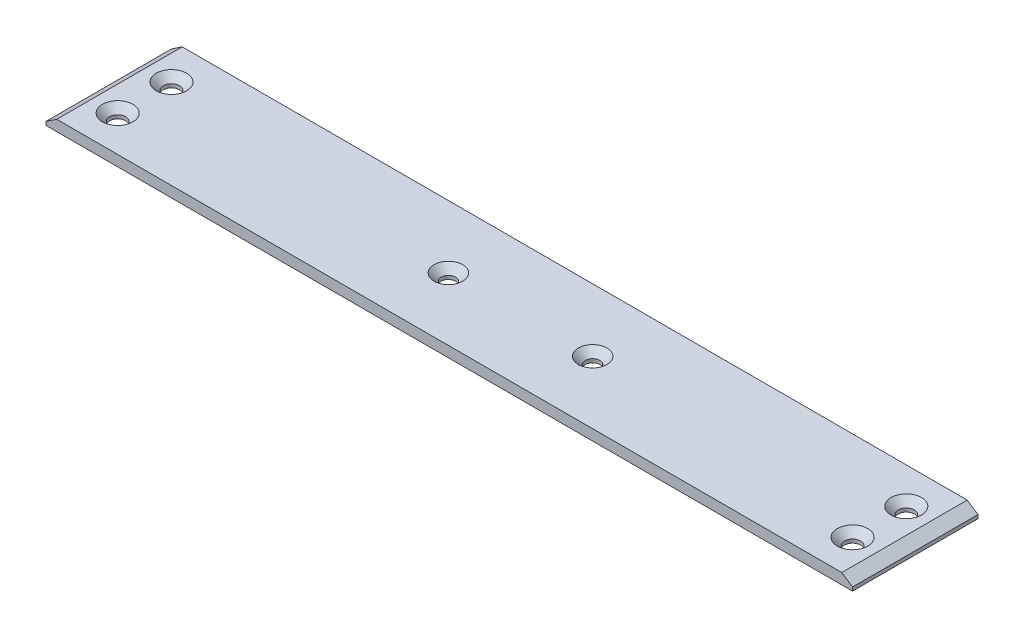
from build123d import *
from OCP.BRepFilletAPI import BRepFilletAPI_MakeChamfer

# Parameters (mm, degrees)
SKETCH1_W                = 225
SKETCH1_H                = 35
BOSS_EXTRUDE1_DEPTH      = 3
CUT_EXTRUDE1_DEPTH       = 114.892493168
CUT_EXTRUDE1_DEPTH_BACK  = 114.892493168
SKETCH3_R                = 2
CHAMFER1_SIZE            = 2
SKETCH4_R                = 2.25
CUT_EXTRUDE2_DEPTH       = 114.892493168
CHAMFER2_SIZE            = 2
CHAMFER2_OF_MIRROR1_SIZE = 2
CHAMFER3_SIZE            = 2
CHAMFER3_SIZE2           = 3


with BuildPart() as part:
    # Sketch1 → Boss-Extrude1 (new body)
    with BuildSketch(Plane(origin=(0, 0, 0), x_dir=(1, 0, 0), z_dir=(0, 1, 0))):
        Rectangle(SKETCH1_W, SKETCH1_H)
    extrude(amount=BOSS_EXTRUDE1_DEPTH)

    # Sketch3 → Cut-Extrude1 (cut, two sides: drawn at the far end of the back side and taken through both)
    with BuildSketch(Plane(origin=(0, 3, 0), x_dir=(1, 0, 0), z_dir=(0, 1, 0)).offset(-CUT_EXTRUDE1_DEPTH_BACK)):
        with Locations((-17.75, 0)):
            Circle(SKETCH3_R)
        with Locations((22.5, 0)):
            Circle(SKETCH3_R)
    extrude(amount=CUT_EXTRUDE1_DEPTH + CUT_EXTRUDE1_DEPTH_BACK, mode=Mode.SUBTRACT)

    # Chamfer1
    chamfer1_edges = [part.edges().sort_by_distance(p)[0] for p in [
        (20.5, 3, 0),
        (-19.75, 3, 0),
    ]]
    chamfer(chamfer1_edges, length=CHAMFER1_SIZE)

    # Sketch4 → Cut-Extrude2 (cut, symmetric)
    with BuildSketch(Plane(origin=(0, 3, 0), x_dir=(1, 0, 0), z_dir=(0, 1, 0))):
        with Locations((-102.5, 7.5)):
            Circle(SKETCH4_R)
        with Locations((-102.5, -7.5)):
            Circle(SKETCH4_R)
    cut_extrude2 = extrude(amount=CUT_EXTRUDE2_DEPTH, both=True, mode=Mode.SUBTRACT)

    # Chamfer2
    chamfer2_edges = [part.edges().sort_by_distance(p)[0] for p in [
        (-104.75, 3, 7.5),
        (-104.75, 3, -7.5),
    ]]
    chamfer(chamfer2_edges, length=CHAMFER2_SIZE)

    # Mirror1: Cut-Extrude2 across plane
    add(cut_extrude2.mirror(Plane(origin=(0, 0, 0), x_dir=(0, 0, 1), z_dir=(1, 0, 0))), mode=Mode.SUBTRACT)

    # Chamfer2 of Mirror1
    chamfer2_of_mirror1_edges = [part.edges().sort_by_distance(p)[0] for p in [
        (104.75, 3, 7.5),
        (104.75, 3, -7.5),
    ]]
    chamfer(chamfer2_of_mirror1_edges, length=CHAMFER2_OF_MIRROR1_SIZE)

    # Chamfer3: one chamfer whose edges measure the first distance from different faces: ONE call of the kernel's chamfer builder (chamfer() names one face for all edges)
    chamfer3_edges_1 = [part.edges().sort_by_distance(p)[0] for p in [
        (112.5, 3, 0),
    ]]
    chamfer3_side_1 = [part.faces().sort_by_distance(p)[0] for p in [
        (112.5, 1.5, 0),
    ]]
    chamfer3_edges_2 = [part.edges().sort_by_distance(p)[0] for p in [
        (-112.5, 3, 0),
    ]]
    chamfer3_side_2 = [part.faces().sort_by_distance(p)[0] for p in [
        (-112.5, 1.5, 0),
    ]]
    chamfer3 = BRepFilletAPI_MakeChamfer(part.part.solid().wrapped)
    for e in chamfer3_edges_1:
        chamfer3.Add(CHAMFER3_SIZE, CHAMFER3_SIZE2, e.wrapped, chamfer3_side_1[0].wrapped)  # the first distance lies on this face
    for e in chamfer3_edges_2:
        chamfer3.Add(CHAMFER3_SIZE, CHAMFER3_SIZE2, e.wrapped, chamfer3_side_2[0].wrapped)  # the first distance lies on this face
    add(Compound.cast(chamfer3.Shape()), mode=Mode.REPLACE)


solid = part.part
